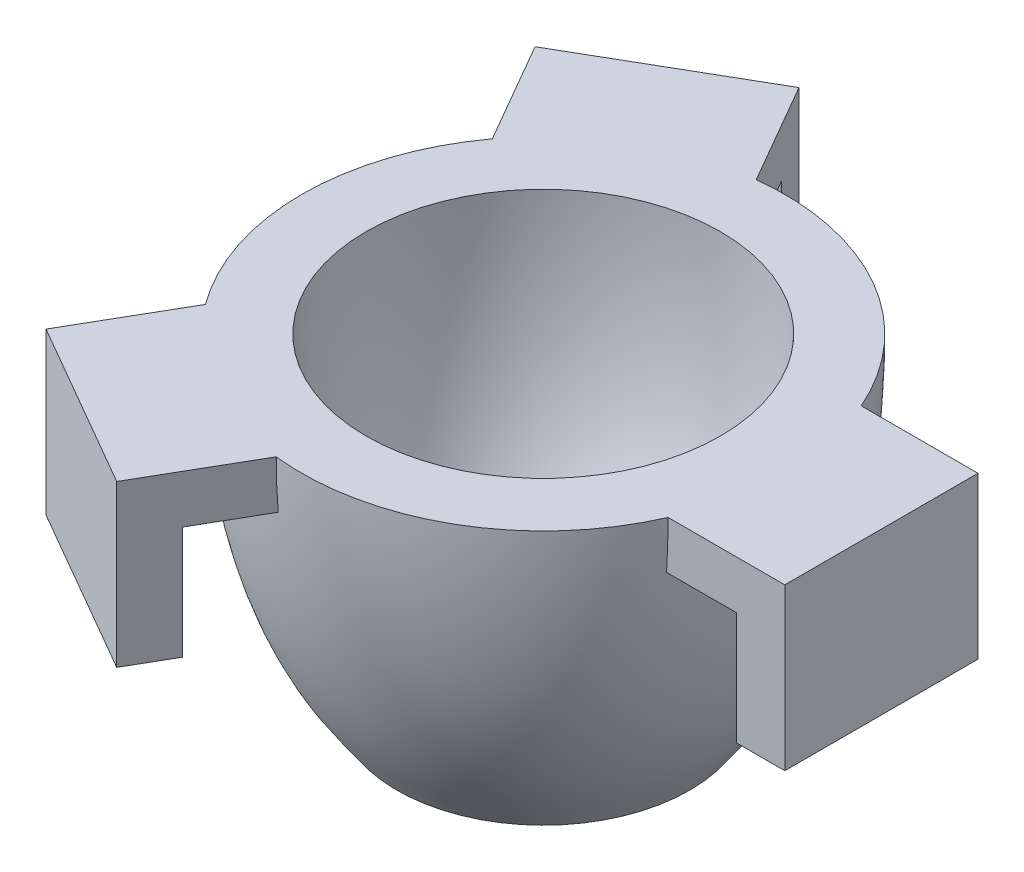
from build123d import *

# Parameters (mm, degrees)
BOSS_EXTRUDE1_DEPTH = 3
CIRPATTERN1_COUNT   = 3
SKETCH7_R           = 3.5
CUT_EXTRUDE1_DEPTH  = 17.925345079


with BuildPart() as part:
    # Sketch5 → Revolve1 (revolve)
    with BuildSketch(Plane.XY):
        with BuildLine():
            Line((0, 0), (3.5, 0))
            add(Edge.make_bspline(
                [(3.5, 0), (5.5, 2.892398465), (5.5, 8)],
                knots=[0, 0, 0, 1, 1, 1], degree=2))
            Line((5.5, 8), (7.5, 8))
            add(Edge.make_bspline(
                [(4.548630039, -2), (4.768119119, -1.681198174), (5.11377029, -1.18590734), (5.465570021, -0.655104648), (5.856736077, 0.026235607), (6.333697609, 1.039889292), (6.877336658, 2.588169998), (7.505279443, 5.632173089), (7.5, 8)],
                knots=[-0.149100199, -0.149100199, -0.149100199, -0.041372056, 0.030446707, 0.102265469, 0.209993613, 0.353631138, 0.569087425, 1, 1, 1], degree=2))
            Line((4.548630039, -2), (0, -2))
            Line((0, -2), (0, 0))
        make_face()
    revolve(axis=Axis((0, 0, 0), (0, 1, 0)))

    # Sketch6 → Boss-Extrude1 (add, symmetric)
    with BuildSketch(Plane.XY):
        Polygon((10.5, 8), (5.5, 8), (5.5, 6.5), (9, 6.5), (9, 3), (10.5, 3), align=None)
    boss_extrude1 = extrude(amount=BOSS_EXTRUDE1_DEPTH, both=True)

    # CirPattern1: Boss-Extrude1 ×3 about axis
    cirpattern1_axis = Axis((0, 8, 0), (0, -1, 0))
    for i in range(1, CIRPATTERN1_COUNT):
        add(boss_extrude1.rotate(cirpattern1_axis, i * 360 / CIRPATTERN1_COUNT))

    # Sketch7 → Cut-Extrude1 (cut, through all)
    with BuildSketch(Plane(origin=(0, 0, 0), x_dir=(1, 0, 0), z_dir=(0, 1, 0))):
        Circle(SKETCH7_R)
    extrude(amount=-CUT_EXTRUDE1_DEPTH, mode=Mode.SUBTRACT)


solid = part.part
